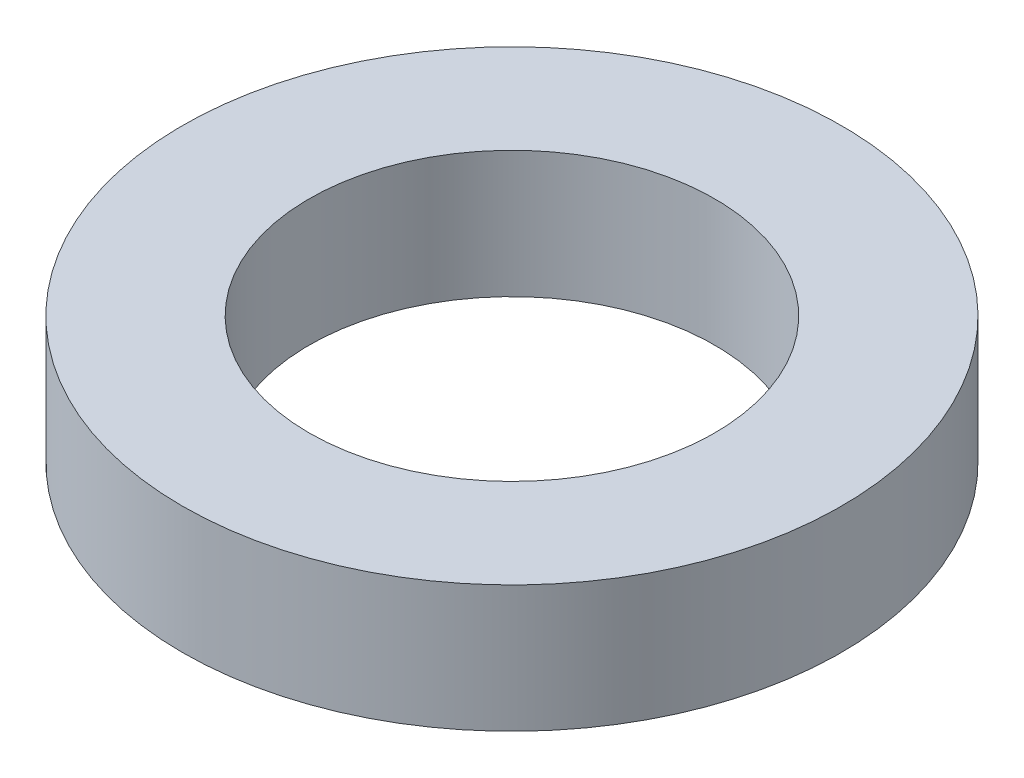
from build123d import *

# Parameters (mm, degrees)
SKETCH1_R           = 65
BOSS_EXTRUDE1_DEPTH = 25
SKETCH2_R           = 40
CUT_EXTRUDE1_DEPTH  = 96.262794416


with BuildPart() as part:
    # Sketch1 → Boss-Extrude1 (new body)
    with BuildSketch(Plane(origin=(0, 0, 0), x_dir=(1, 0, 0), z_dir=(0, 1, 0))):
        Circle(SKETCH1_R)
    extrude(amount=BOSS_EXTRUDE1_DEPTH)

    # Sketch2 → Cut-Extrude1 (cut, through all)
    with BuildSketch(Plane(origin=(0, 0, 0), x_dir=(1, 0, 0), z_dir=(0, 1, 0))):
        Circle(SKETCH2_R)
    extrude(amount=CUT_EXTRUDE1_DEPTH, mode=Mode.SUBTRACT)


solid = part.part
